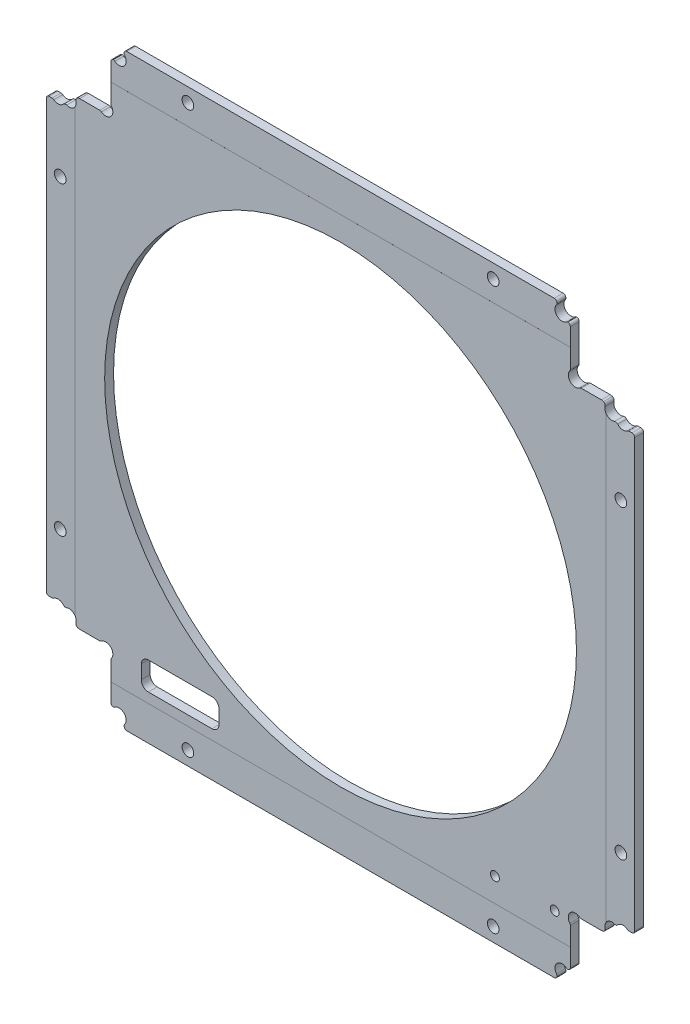
from build123d import *

# Parameters (mm, degrees)
SKETCH1_W                           = 106
SKETCH1_H                           = 106
MAINOUTLINE_DEPTH                   = 1.6
SKETCH4_W                           = 11.6
SKETCH4_H                           = 11.6
RAILCUTOUTS_DEPTH                   = 75.970394157
SKETCH13_W                          = 2.4
SKETCH13_H                          = 2.5
FILLETCUTOUTS_DEPTH                 = 75.970394157
DOGBONE_DEPTH                       = 75.970394157
SKETCH_PATTERN1_DEPTH               = 1.6
MIRROR2_COPY_1_SKETCH_W             = 11.6
MIRROR2_COPY_1_SKETCH_H             = 11.6
MIRROR2_COPY_1_DEPTH                = 75.970394157
MIRROR2_COPY_2_SKETCH_W             = 2.4
MIRROR2_COPY_2_SKETCH_H             = 2.5
MIRROR2_COPY_2_DEPTH                = 75.970394157
MIRROR2_COPY_3_DEPTH                = 75.970394157
MIRROR2_COPY_4_DEPTH                = 1.6
FILLET1_R                           = 0.5
M2_CLEARANCE_HOLE1_D                = 2.1
INTERBOARDCONNECTORHOLES_DEPTH      = 75.970394157
INTERBOARDCONNECTORHOLES_DEPTH_BACK = 75.970394157
SKETCH12_R                          = 0.8
CUT_EXTRUDE7_DEPTH                  = 75.970394157
CUT_EXTRUDE7_DEPTH_BACK             = 75.970394157
SKETCH17_W                          = 14
SKETCH17_H                          = 5
FILLET2_R                           = 1.27
CUT_EXTRUDE1_DEPTH                  = 75.970394157
CUT_EXTRUDE1_DEPTH_BACK             = 75.970394157
SKETCH10_R                          = 42.5
SKETCH16_W                          = 90
SKETCH16_H                          = 6.2
SKETCH16_W_2                        = 5.2
SKETCH16_H_2                        = 90
CUT_EXTRUDE6_DEPTH                  = 0.001


# Read off the part's stored shape, not the designer's step: Sketch-Pattern1
with BuildPart() as part:
    # Sketch1 → mainOutline (new body)
    with BuildSketch(Plane.XY):
        Rectangle(SKETCH1_W, SKETCH1_H)
    extrude(amount=MAINOUTLINE_DEPTH)

    # Sketch4 → railCutouts (cut, through all)
    with BuildSketch(Plane(origin=(0, 0, 0), x_dir=(-1, 0, 0), z_dir=(0, 0, -1))):
        with Locations((47.2, 47.2)):
            Rectangle(SKETCH4_W, SKETCH4_H)
    railcutouts = extrude(amount=-RAILCUTOUTS_DEPTH, mode=Mode.SUBTRACT)

    # Sketch13 → filletCutouts (cut, symmetric)
    with BuildSketch(Plane(origin=(0, 0, 0), x_dir=(-1, 0, 0), z_dir=(0, 0, -1))):
        with BuildLine():
            Line((48, 39.5), (48, 40.4))
            ThreePointArc((48, 40.4), (47.707106781, 41.107106781), (47, 41.4))
            Line((47, 41.4), (53, 41.4))
            Line((53, 41.4), (53, 39))
            Line((53, 39), (50, 39))
            Line((50, 39), (50, 39.5))
            Line((50, 39.5), (48, 39.5))
        make_face()
        with Locations((40.2, 51.75)):
            Rectangle(SKETCH13_W, SKETCH13_H)
    filletcutouts = extrude(amount=FILLETCUTOUTS_DEPTH, both=True, mode=Mode.SUBTRACT)

    # Sketch5 → dogbone (cut, through all)
    with BuildSketch(Plane(origin=(0, 0, 0), x_dir=(-1, 0, 0), z_dir=(0, 0, -1))):
        with BuildLine():
            Line((41.4, 43.196051224), (44.582309033, 46.378360258))
            ThreePointArc((44.582309033, 46.378360258), (46.378360258, 46.378360258), (46.378360258, 44.582309033))
            Line((46.378360258, 44.582309033), (43.196051224, 41.4))
            ThreePointArc((43.196051224, 41.4), (41.4, 41.4), (41.4, 43.196051224))
        make_face()
    dogbone = extrude(amount=-DOGBONE_DEPTH, mode=Mode.SUBTRACT)

    # Sketch-Pattern1 outline → Sketch-Pattern1 (cut)
    with BuildSketch(Plane.XY):
        with BuildLine():
            ThreePointArc((-51.796051224, 39), (-50.898025612, 38.628025612), (-50, 39))
            Line((-50, 39), (-51.796051224, 39))
        make_face()
        with BuildLine():
            Line((-48, 40.4), (-48, 39.5))
            ThreePointArc((-48, 39.5), (-47.640251053, 40.222232671), (-47.788196764, 41.015423319))
            ThreePointArc((-47.788196764, 41.015423319), (-47.945567756, 40.725425288), (-48, 40.4))
        make_face()
        with BuildLine():
            ThreePointArc((-50, 39), (-49.837206518, 39.199768603), (-49.718090983, 39.428287097))
            ThreePointArc((-49.718090983, 39.428287097), (-48.845062088, 39.129130476), (-48, 39.5))
            Line((-48, 39.5), (-50, 39.5))
            Line((-50, 39.5), (-50, 39))
        make_face()
        with BuildLine():
            ThreePointArc((-40.796051224, 50.5), (-39.898025612, 50.128025612), (-39, 50.5))
            Line((-39, 50.5), (-40.796051224, 50.5))
        make_face()
        with BuildLine():
            ThreePointArc((-39, 50.5), (-38.628025612, 51.398025612), (-39, 52.296051224))
            Line((-39, 52.296051224), (-39, 50.5))
        make_face()
    sketch_pattern1 = extrude(amount=SKETCH_PATTERN1_DEPTH, mode=Mode.SUBTRACT)

    # Mirror1: railCutouts, filletCutouts, dogbone, Sketch-Pattern1 across plane
    add(railcutouts.mirror(Plane(origin=(0, 0, 0), x_dir=(0, 0, 1), z_dir=(1, 0, 0))), mode=Mode.SUBTRACT)
    add(filletcutouts.mirror(Plane(origin=(0, 0, 0), x_dir=(0, 0, 1), z_dir=(1, 0, 0))), mode=Mode.SUBTRACT)
    add(dogbone.mirror(Plane(origin=(0, 0, 0), x_dir=(0, 0, 1), z_dir=(1, 0, 0))), mode=Mode.SUBTRACT)
    add(sketch_pattern1.mirror(Plane(origin=(0, 0, 0), x_dir=(0, 0, 1), z_dir=(1, 0, 0))), mode=Mode.SUBTRACT)

    # Mirror2: railCutouts, filletCutouts, dogbone, Sketch-Pattern1 across plane
    add(railcutouts.mirror(Plane.ZX), mode=Mode.SUBTRACT)
    add(filletcutouts.mirror(Plane.ZX), mode=Mode.SUBTRACT)
    add(dogbone.mirror(Plane.ZX), mode=Mode.SUBTRACT)
    add(sketch_pattern1.mirror(Plane.ZX), mode=Mode.SUBTRACT)

    # Mirror2 copy 1 sketch → Mirror2 copy 1 (cut, through all)
    with BuildSketch(Plane(origin=(0, 0, 0), x_dir=(1, 0, 0), z_dir=(0, 0, -1))):
        with Locations((47.2, 47.2)):
            Rectangle(MIRROR2_COPY_1_SKETCH_W, MIRROR2_COPY_1_SKETCH_H)
    extrude(amount=-MIRROR2_COPY_1_DEPTH, mode=Mode.SUBTRACT)

    # Mirror2 copy 2 sketch → Mirror2 copy 2 (cut, symmetric)
    with BuildSketch(Plane(origin=(0, 0, 0), x_dir=(1, 0, 0), z_dir=(0, 0, -1))):
        with BuildLine():
            Line((48, 39.5), (48, 40.4))
            ThreePointArc((48, 40.4), (47.707106781, 41.107106781), (47, 41.4))
            Line((47, 41.4), (53, 41.4))
            Line((53, 41.4), (53, 39))
            Line((53, 39), (50, 39))
            Line((50, 39), (50, 39.5))
            Line((50, 39.5), (48, 39.5))
        make_face()
        with Locations((40.2, 51.75)):
            Rectangle(MIRROR2_COPY_2_SKETCH_W, MIRROR2_COPY_2_SKETCH_H)
    extrude(amount=MIRROR2_COPY_2_DEPTH, both=True, mode=Mode.SUBTRACT)

    # Mirror2 copy 3 sketch → Mirror2 copy 3 (cut, through all)
    with BuildSketch(Plane(origin=(0, 0, 0), x_dir=(1, 0, 0), z_dir=(0, 0, -1))):
        with BuildLine():
            Line((41.4, 43.196051224), (44.582309033, 46.378360258))
            ThreePointArc((44.582309033, 46.378360258), (46.378360258, 46.378360258), (46.378360258, 44.582309033))
            Line((46.378360258, 44.582309033), (43.196051224, 41.4))
            ThreePointArc((43.196051224, 41.4), (41.4, 41.4), (41.4, 43.196051224))
        make_face()
    extrude(amount=-MIRROR2_COPY_3_DEPTH, mode=Mode.SUBTRACT)

    # Mirror2 copy 4 sketch → Mirror2 copy 4 (cut)
    with BuildSketch(Plane(origin=(0, 0, 0), x_dir=(-1, 0, 0), z_dir=(0, 0, 1))):
        with BuildLine():
            ThreePointArc((-51.796051224, 39), (-50.898025612, 38.628025612), (-50, 39))
            Line((-50, 39), (-51.796051224, 39))
        make_face()
        with BuildLine():
            Line((-48, 40.4), (-48, 39.5))
            ThreePointArc((-48, 39.5), (-47.640251053, 40.222232671), (-47.788196764, 41.015423319))
            ThreePointArc((-47.788196764, 41.015423319), (-47.945567756, 40.725425288), (-48, 40.4))
        make_face()
        with BuildLine():
            ThreePointArc((-50, 39), (-49.837206518, 39.199768603), (-49.718090983, 39.428287097))
            ThreePointArc((-49.718090983, 39.428287097), (-48.845062088, 39.129130476), (-48, 39.5))
            Line((-48, 39.5), (-50, 39.5))
            Line((-50, 39.5), (-50, 39))
        make_face()
        with BuildLine():
            ThreePointArc((-40.796051224, 50.5), (-39.898025612, 50.128025612), (-39, 50.5))
            Line((-39, 50.5), (-40.796051224, 50.5))
        make_face()
        with BuildLine():
            ThreePointArc((-39, 50.5), (-38.628025612, 51.398025612), (-39, 52.296051224))
            Line((-39, 52.296051224), (-39, 50.5))
        make_face()
    extrude(amount=MIRROR2_COPY_4_DEPTH, mode=Mode.SUBTRACT)

    # Fillet1
    # the kernel refuses this fillet: 0.5 mm, written as the material it takes off along each edge
    with BuildSketch(Plane(origin=(-40.796051224, 50.5, -0.468817401), x_dir=(-1, 0, 0), z_dir=(0, 0, 1)), Plane(origin=(41.4, 43.196051224, -0.468817401), x_dir=(0, 1, 0), z_dir=(0, 0, 1)), Plane(origin=(39, 52.296051224, -0.468817401), x_dir=(0, 1, 0), z_dir=(0, 0, 1)), Plane(origin=(43.196051224, -41.4, -0.468817401), x_dir=(1, 0, 0), z_dir=(0, 0, 1)), Plane(origin=(40.796051224, -50.5, -0.468817401), x_dir=(1, 0, 0), z_dir=(0, 0, 1)), Plane(origin=(51.796051224, -39, -0.468817401), x_dir=(1, 0, 0), z_dir=(0, 0, 1)), Plane(origin=(-41.4, -43.196051224, -0.468817401), x_dir=(0, -1, 0), z_dir=(0, 0, 1)), Plane(origin=(-39, -52.296051224, -0.468817401), x_dir=(0, -1, 0), z_dir=(0, 0, 1)), Plane(origin=(-43.196051224, 41.4, -0.468817401), x_dir=(-1, 0, 0), z_dir=(0, 0, 1))) as fillet1_piece_1:
        with BuildLine():
            CenterArc((0.187526961, 0.5), FILLET1_R, 232.171026852, 37.828973148)
            ThreePointArc((-0.119126309, 0.105077511), (-0.057918706, 0.054403066), (0, 0))
            Line((0, 0), (0.187526961, 0))
        make_face()
    extrude(amount=2.537634803, mode=Mode.SUBTRACT)
    with BuildSketch(Plane(origin=(-39, 52.296051224, -0.468817401), x_dir=(0, 1, 0), z_dir=(0, 0, 1))) as fillet1_piece_2:
        with BuildLine():
            CenterArc((0.187526961, -0.5), FILLET1_R, 90, 37.828973148)
            ThreePointArc((-0.119126309, -0.105077511), (-0.057918706, -0.054403066), (0, 0))
            Line((0, 0), (0.187526961, 0))
        make_face()
    extrude(amount=2.537634803, mode=Mode.SUBTRACT)
    with BuildSketch(Plane(origin=(-49.718090983, 39.428287097, -1.02833381), x_dir=(-0.5154483763145984, -0.8569206330545696, 0), z_dir=(0, 0, 1)), Plane(origin=(49.718090983, 39.428287097, -1.02833381), x_dir=(-0.8580641587400395, -0.5135425001747647, 0), z_dir=(0, 0, 1)), Plane(origin=(49.718090983, -39.428287097, -1.02833381), x_dir=(0.5154483763145984, 0.8569206330545696, 0), z_dir=(0, 0, 1)), Plane(origin=(-49.718090983, -39.428287097, -1.02833381), x_dir=(0.8580641587400395, 0.5135425001747647, 0), z_dir=(0, 0, 1))) as fillet1_piece_3:
        with BuildLine():
            CenterArc((0.49230469, 0.493400112), FILLET1_R, 189.447000606, 71.233345199)
            ThreePointArc((-0.000914235, 0.411332508), (0.016306557, 0.205703513), (0, 0))
            ThreePointArc((0, 0), (0.205666762, 0.016763716), (0.411333524, 0))
        make_face()
    extrude(amount=3.65666762, mode=Mode.SUBTRACT)
    with BuildSketch(Plane(origin=(-51.796051224, 39, -0.468817401), x_dir=(0.74994384051794, -0.6615015011843909, 0), z_dir=(0, 0, 1))) as fillet1_piece_4:
        with BuildLine():
            CenterArc((0.190116062, -0.499021286), FILLET1_R, 93.585513434, 37.828973148)
            Line((-0.140634689, -0.124049366), (0, 0))
            ThreePointArc((0, 0), (0.079423486, -0.002485933), (0.158846972, 0))
        make_face()
    extrude(amount=2.537634803, mode=Mode.SUBTRACT)
    with BuildSketch(Plane(origin=(53, 39, -1.25), x_dir=(-1, 0, 0), z_dir=(0, 0, 1)), Plane(origin=(41.4, 50.5, -1.25), x_dir=(-1, 0, 0), z_dir=(0, 0, 1)), Plane(origin=(53, -39, -1.25), x_dir=(0, 1, 0), z_dir=(0, 0, 1)), Plane(origin=(41.4, -50.5, -1.25), x_dir=(0, 1, 0), z_dir=(0, 0, 1)), Plane(origin=(-53, 39, -1.25), x_dir=(0, -1, 0), z_dir=(0, 0, 1)), Plane(origin=(-53, -39, -1.25), x_dir=(1, 0, 0), z_dir=(0, 0, 1)), Plane(origin=(-41.4, -50.5, -1.25), x_dir=(1, 0, 0), z_dir=(0, 0, 1)), Plane(origin=(-41.4, 50.5, -1.25), x_dir=(0, -1, 0), z_dir=(0, 0, 1)), Plane(origin=(-39, 53, 2.85), x_dir=(1, 0, 0), z_dir=(0, 0, -1))) as fillet1_piece_5:
        with BuildLine():
            CenterArc((FILLET1_R, FILLET1_R), FILLET1_R, 180, 90)
            Line((0, FILLET1_R), (0, 0))
            Line((0, 0), (FILLET1_R, 0))
        make_face()
    extrude(amount=4.1, mode=Mode.SUBTRACT)
    with BuildSketch(Plane(origin=(39, 53, 2.85), x_dir=(-1, 0, 0), z_dir=(0, 0, -1)), Plane(origin=(39, -53, 2.85), x_dir=(0, 1, 0), z_dir=(0, 0, -1)), Plane(origin=(-39, -53, 2.85), x_dir=(1, 0, 0), z_dir=(0, 0, -1))) as fillet1_piece_6:
        with BuildLine():
            CenterArc((FILLET1_R, -FILLET1_R), FILLET1_R, 90, 90)
            Line((0, -FILLET1_R), (0, 0))
            Line((0, 0), (FILLET1_R, 0))
        make_face()
    extrude(amount=4.1, mode=Mode.SUBTRACT)
    with BuildSketch(Plane(origin=(43.196051224, 41.4, -0.468817401), x_dir=(-0.7499438406786088, -0.6615015010022407, 0), z_dir=(0, 0, 1)), Plane(origin=(40.796051224, 50.5, -0.468817401), x_dir=(-0.7499438405179647, -0.6615015011843627, 0), z_dir=(0, 0, 1)), Plane(origin=(51.796051224, 39, -0.468817401), x_dir=(-0.74994384051794, -0.6615015011843909, 0), z_dir=(0, 0, 1)), Plane(origin=(41.4, -43.196051224, -0.468817401), x_dir=(-0.6615015010022215, 0.7499438406786257, 0), z_dir=(0, 0, 1)), Plane(origin=(39, -52.296051224, -0.468817401), x_dir=(-0.6615015011843849, 0.7499438405179452, 0), z_dir=(0, 0, 1)), Plane(origin=(-43.196051224, -41.4, -0.468817401), x_dir=(0.7499438406786088, 0.6615015010022407, 0), z_dir=(0, 0, 1)), Plane(origin=(-40.796051224, -50.5, -0.468817401), x_dir=(0.7499438405179647, 0.6615015011843627, 0), z_dir=(0, 0, 1)), Plane(origin=(-51.796051224, -39, -0.468817401), x_dir=(0.74994384051794, 0.6615015011843909, 0), z_dir=(0, 0, 1)), Plane(origin=(-41.4, 43.196051224, -0.468817401), x_dir=(0.6615015010022215, -0.7499438406786257, 0), z_dir=(0, 0, 1))) as fillet1_piece_7:
        with BuildLine():
            CenterArc((0.190116062, 0.499021286), FILLET1_R, 228.585513432, 37.828973137)
            Line((-0.140634689, 0.124049366), (0, 0))
            ThreePointArc((0, 0), (0.079423486, 0.002485933), (0.158846972, 0))
        make_face()
    extrude(amount=2.537634803, mode=Mode.SUBTRACT)
    with BuildSketch(Plane(origin=(47.788196764, 41.015423319, -1.280506532), x_dir=(-0.796757139689439, 0.6042996445091655, 0), z_dir=(0, 0, 1)), Plane(origin=(-47.788196764, -41.015423319, -1.280506532), x_dir=(0.796757139689439, -0.6042996445091655, 0), z_dir=(0, 0, 1))) as fillet1_piece_8:
        with BuildLine():
            CenterArc((0.384151959, 0.483324974), FILLET1_R, 201.96594505, 82.872907469)
            ThreePointArc((-0.079551214, 0.296297256), (-0.030795766, 0.150559576), (0, 0))
            ThreePointArc((0, 0), (0.256101306, -0.033350053), (0.512202613, 0))
        make_face()
    extrude(amount=4.161013063, mode=Mode.SUBTRACT)
    with BuildSketch(Plane(origin=(47.788196764, -41.015423319, -1.280506532), x_dir=(-0.3770302508373224, 0.9262009446948031, 0), z_dir=(0, 0, 1)), Plane(origin=(-47.788196764, 41.015423319, -1.280506532), x_dir=(0.3770302508373224, -0.9262009446948031, 0), z_dir=(0, 0, 1))) as fillet1_piece_9:
        with BuildLine():
            CenterArc((0.367182425, 0.496339425), FILLET1_R, 180.189758693, 82.872907469)
            ThreePointArc((-0.132814833, 0.494683471), (-0.098616779, 0.238694022), (0, 0))
            ThreePointArc((0, 0), (0.153395289, 0.00929786), (0.306790579, 0))
        make_face()
    extrude(amount=4.161013063, mode=Mode.SUBTRACT)

    # M2 Clearance Hole1 (through all)
    with Locations(Plane(origin=(0, 0, 0), x_dir=(-1, 0, 0), z_dir=(0, 0, -1))):
        with Locations((50.5, -27.5), (27.5, -50.5), (-50.5, -27.5), (-27.5, -50.5), (-27.5, 50.5), (-50.5, 27.5), (27.5, 50.5), (50.5, 27.5)):
            Hole(M2_CLEARANCE_HOLE1_D / 2)

    # Sketch12 → interboardConnectorHoles (cut, two sides: drawn at the far end of the back side and taken through both)
    with BuildSketch(Plane.XY.offset(1.6).offset(-INTERBOARDCONNECTORHOLES_DEPTH_BACK)):
        with Locations((27.815, -42.5)):
            Circle(SKETCH12_R)
        with Locations((38.585, -42.5)):
            Circle(SKETCH12_R)
    extrude(amount=INTERBOARDCONNECTORHOLES_DEPTH + INTERBOARDCONNECTORHOLES_DEPTH_BACK, mode=Mode.SUBTRACT)

    # Sketch17 → Cut-Extrude7 (cut, two sides: drawn at the far end of the back side and taken through both)
    with BuildSketch(Plane.XY.offset(1.6).offset(-CUT_EXTRUDE7_DEPTH_BACK)):
        with Locations((-28.9, -42.5)):
            Rectangle(SKETCH17_W, SKETCH17_H)
    extrude(amount=CUT_EXTRUDE7_DEPTH + CUT_EXTRUDE7_DEPTH_BACK, mode=Mode.SUBTRACT)

    # Fillet2
    fillet2_edges = [part.edges().sort_by_distance(p)[0] for p in [
        (-35.9, -45, 0.8),
        (-35.9, -40, 0.8),
        (-21.9, -40, 0.8),
        (-21.9, -45, 0.8),
    ]]
    fillet(fillet2_edges, radius=FILLET2_R)

    # Sketch10 → Cut-Extrude1 (cut, two sides: drawn at the far end of the back side and taken through both)
    with BuildSketch(Plane(origin=(0, 0, 0), x_dir=(-1, 0, 0), z_dir=(0, 0, -1)).offset(-CUT_EXTRUDE1_DEPTH_BACK)):
        Circle(SKETCH10_R)
    extrude(amount=CUT_EXTRUDE1_DEPTH + CUT_EXTRUDE1_DEPTH_BACK, mode=Mode.SUBTRACT)

    # Sketch16 → Cut-Extrude6 (cut)
    with BuildSketch(Plane.XY.offset(1.6)):
        with Locations((0, -49.9)):
            Rectangle(SKETCH16_W, SKETCH16_H)
        with Locations((0, 49.9)):
            Rectangle(SKETCH16_W, SKETCH16_H)
        with Locations((-50.4, 0)):
            Rectangle(SKETCH16_W_2, SKETCH16_H_2)
        with Locations((50.4, 0)):
            Rectangle(SKETCH16_W_2, SKETCH16_H_2)
    extrude(amount=-CUT_EXTRUDE6_DEPTH, mode=Mode.SUBTRACT)


solid = part.part
